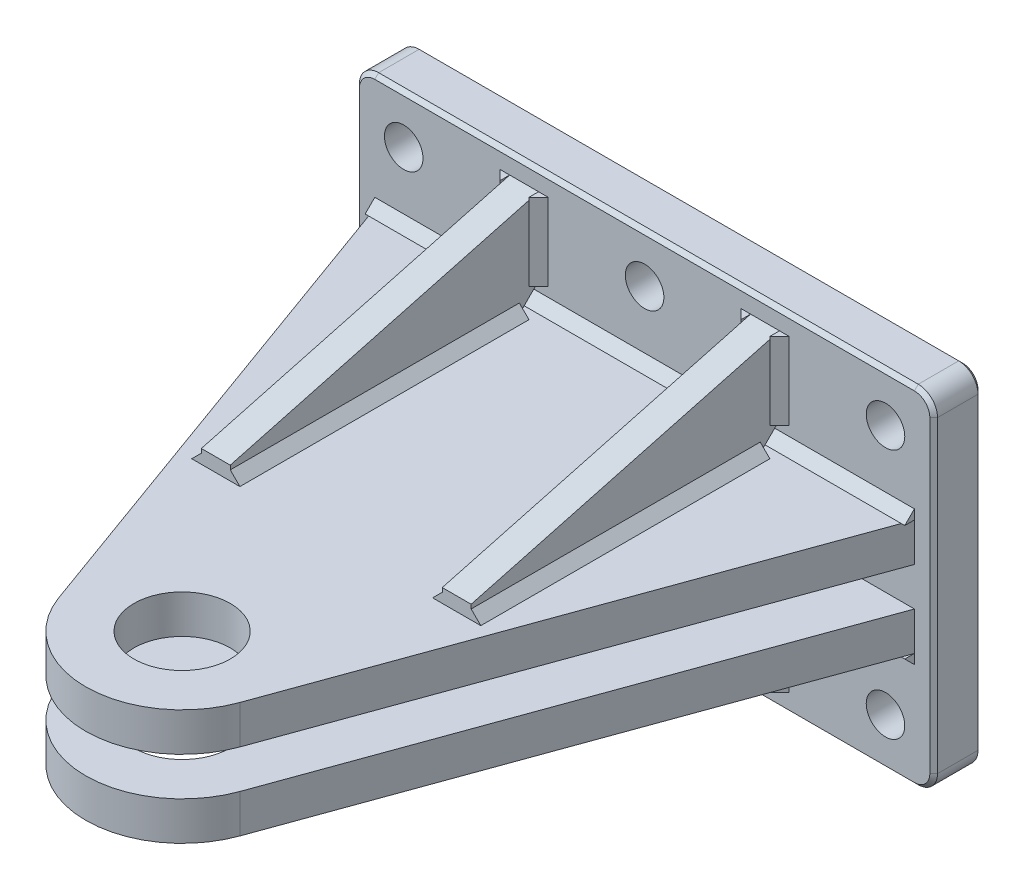
from build123d import *

# Parameters (mm, degrees)
SKETCH1_W           = 300
SKETCH1_H           = 180
SKETCH1_R           = 10
BOSS_EXTRUDE1_DEPTH = 12.5
FILLET1_R           = 10
CHAMFER1_SIZE       = 2
SKETCH6_W           = 280
SKETCH6_H           = 20
BOSS_EXTRUDE3_DEPTH = 290
SKETCH7_R           = 25
CUT_EXTRUDE2_DEPTH  = 359.338178262
SKETCH8_W           = 15
SKETCH8_H           = 50
BOSS_EXTRUDE4_DEPTH = 160
CUT_EXTRUDE3_DEPTH  = 385.715804198
GUSSET1_THICKNESS   = 280
GUSSET2_THICKNESS   = 150
GUSSET3_THICKNESS   = 150
GUSSET4_THICKNESS   = 150
GUSSET5_THICKNESS   = 150
GUSSET6_THICKNESS   = 40
GUSSET7_THICKNESS   = 40
GUSSET8_THICKNESS   = 40
GUSSET9_THICKNESS   = 40
MIRROR1_START       = 22.5
MIRROR1_DEPTH       = 150
MIRROR1_START_2     = -140
MIRROR1_2_DEPTH     = 280
MIRROR1_3_DEPTH     = 150
MIRROR1_START_3     = 40
MIRROR1_4_DEPTH     = 40


with BuildPart() as part:
    # Sketch1 → Boss-Extrude1 (new, symmetric)
    with BuildSketch(Plane.XY):
        Rectangle(SKETCH1_W, SKETCH1_H)
        with Locations((-125, 65)):
            Circle(SKETCH1_R, mode=Mode.SUBTRACT)
        with Locations((0, 65)):
            Circle(SKETCH1_R, mode=Mode.SUBTRACT)
        with Locations((125, 65)):
            Circle(SKETCH1_R, mode=Mode.SUBTRACT)
        with Locations(Location((125, -65, 0), (0, 0, 180))):
            Circle(SKETCH1_R, mode=Mode.SUBTRACT)
        with Locations(Location((0, -65, 0), (0, 0, 180))):
            Circle(SKETCH1_R, mode=Mode.SUBTRACT)
        with Locations(Location((-125, -65, 0), (0, 0, 180))):
            Circle(SKETCH1_R, mode=Mode.SUBTRACT)
    extrude(amount=BOSS_EXTRUDE1_DEPTH, both=True)

    # Fillet1
    fillet1_edges = [part.edges().sort_by_distance(p)[0] for p in [
        (150, -90, 0),
        (-150, -90, 0),
        (-150, 90, 0),
        (150, 90, 0),
    ]]
    fillet(fillet1_edges, radius=FILLET1_R)

    # Chamfer1
    chamfer1_edges = [part.edges().sort_by_distance(p)[0] for p in [
        (0, 90, -12.5),
        (0, 90, 12.5),
        (150, 0, -12.5),
        (0, -90, -12.5),
        (-150, 0, -12.5),
        (-147.071067812, 87.071067812, -12.5),
        (-147.071067812, -87.071067812, -12.5),
        (147.071067812, -87.071067812, -12.5),
        (147.071067812, 87.071067812, -12.5),
        (150, 0, 12.5),
        (-150, 0, 12.5),
        (0, -90, 12.5),
        (-147.071067812, 87.071067812, 12.5),
        (-147.071067812, -87.071067812, 12.5),
        (147.071067812, -87.071067812, 12.5),
        (147.071067812, 87.071067812, 12.5),
    ]]
    chamfer(chamfer1_edges, length=CHAMFER1_SIZE)

    # Sketch6 → Boss-Extrude3 (add)
    with BuildSketch(Plane.XY.offset(12.5)):
        with Locations((0, -20)):
            Rectangle(SKETCH6_W, SKETCH6_H)
        with Locations((0, 20)):
            Rectangle(SKETCH6_W, SKETCH6_H)
    extrude(amount=BOSS_EXTRUDE3_DEPTH)

    # Sketch7 → Cut-Extrude2 (cut, through all)
    with BuildSketch(Plane.XZ.offset(30)):
        with Locations(Location((0, 252.5, 0), (0, 0, 270))):
            Circle(SKETCH7_R)
        with BuildLine():
            Line((-47.017565913, 269.510246783), (-140, 12.5))
            Line((-140, 12.5), (-140, 338.026401393))
            Line((-140, 338.026401393), (140, 338.026401393))
            Line((140, 338.026401393), (140, 12.5))
            Line((140, 12.5), (47.017565913, 269.510246783))
            ThreePointArc((47.017565913, 269.510246783), (0, 302.5), (-47.017565913, 269.510246783))
        make_face()
    extrude(amount=-CUT_EXTRUDE2_DEPTH, mode=Mode.SUBTRACT)

    # Sketch8 → Boss-Extrude4 (add)
    with BuildSketch(Plane.XY.offset(12.5)):
        with Locations((62.5, -55)):
            Rectangle(SKETCH8_W, SKETCH8_H)
        with Locations((-62.5, -55)):
            Rectangle(SKETCH8_W, SKETCH8_H)
        with Locations((62.5, 55)):
            Rectangle(SKETCH8_W, SKETCH8_H)
        with Locations((-62.5, 55)):
            Rectangle(SKETCH8_W, SKETCH8_H)
    extrude(amount=BOSS_EXTRUDE4_DEPTH)

    # Sketch9 → Cut-Extrude3 (cut, through all)
    with BuildSketch(Plane.ZY.offset(70)):
        Polygon((12.5, 80), (172.5, 37.128129211), (172.5, 80), align=None)
        Polygon((22.5, 30), (12.5, 40), (12.5, 30), align=None)
        Polygon((12.5, -40), (12.5, -30), (22.5, -30), align=None)
        Polygon((172.5, -37.128129211), (176.037028875, -86.220399065), (12.5, -80), align=None)
    extrude(amount=-CUT_EXTRUDE3_DEPTH, mode=Mode.SUBTRACT)

    # Mirror1: read off the stored shape, not the designer's step
    # Mirror1 outline → Mirror1 (add)
    with BuildSketch(Plane.XY.offset(MIRROR1_START)):
        Polygon((70, 35), (70, 30), (75, 30), align=None)
        Polygon((-75, 30), (-70, 30), (-70, 35), align=None)
        Polygon((-50, 30), (-55, 35), (-55, 30), align=None)
    extrude(amount=MIRROR1_DEPTH)

    # Mirror1 2 outline → Mirror1 2 (add)
    with BuildSketch(Plane.YZ.offset(MIRROR1_START_2)):
        Polygon((30, 17.5), (30, 12.5), (35, 12.5), align=None)
    extrude(amount=MIRROR1_2_DEPTH)

    # Mirror1 3 outline → Mirror1 3 (add)
    with BuildSketch(Plane.XY.offset(MIRROR1_START)):
        Polygon((55, 35), (50, 30), (55, 30), align=None)
    extrude(amount=MIRROR1_3_DEPTH)

    # Mirror1 4 outline → Mirror1 4 (add)
    with BuildSketch(Plane(origin=(0, 0, 0), x_dir=(1, 0, 0), z_dir=(0, 1, 0)).offset(MIRROR1_START_3)):
        Polygon((-70, -17.5), (-70, -12.5), (-75, -12.5), align=None)
        Polygon((75, -12.5), (70, -12.5), (70, -17.5), align=None)
        Polygon((55, -12.5), (50, -12.5), (55, -17.5), align=None)
        Polygon((-55, -17.5), (-50, -12.5), (-55, -12.5), align=None)
    extrude(amount=MIRROR1_4_DEPTH)


with BuildPart() as body_2:
    # Gusset1: a gusset: a plate 280.0 thick in the corner of two members, its outline drawn in place
    gusset1_outline = Wire([Line((-140, -30, 12.5), (-140, -35, 12.5)), Line((-140, -35, 12.5), (-140, -30, 17.5)), Line((-140, -30, 17.5), (-140, -30, 12.5))])
    add(extrude(Face(gusset1_outline), amount=GUSSET1_THICKNESS, dir=(1, 0, 0)))


with BuildPart() as body_3:
    # Gusset2: a gusset: a plate 150.0 thick in the corner of two members, its outline drawn in place
    gusset2_outline = Wire([Line((-55, -30, 22.5), (-50, -30, 22.5)), Line((-50, -30, 22.5), (-55, -35, 22.5)), Line((-55, -35, 22.5), (-55, -30, 22.5))])
    add(extrude(Face(gusset2_outline), amount=GUSSET2_THICKNESS, dir=(0, 0, 1)))


with BuildPart() as body_4:
    # Gusset3: a gusset: a plate 150.0 thick in the corner of two members, its outline drawn in place
    gusset3_outline = Wire([Line((55, -30, 172.5), (50, -30, 172.5)), Line((50, -30, 172.5), (55, -35, 172.5)), Line((55, -35, 172.5), (55, -30, 172.5))])
    add(extrude(Face(gusset3_outline), amount=GUSSET3_THICKNESS, dir=(0, 0, -1)))


with BuildPart() as body_5:
    # Gusset4: a gusset: a plate 150.0 thick in the corner of two members, its outline drawn in place
    gusset4_outline = Wire([Line((70, -30, 22.5), (75, -30, 22.5)), Line((75, -30, 22.5), (70, -35, 22.5)), Line((70, -35, 22.5), (70, -30, 22.5))])
    add(extrude(Face(gusset4_outline), amount=GUSSET4_THICKNESS, dir=(0, 0, 1)))


with BuildPart() as body_6:
    # Gusset5: a gusset: a plate 150.0 thick in the corner of two members, its outline drawn in place
    gusset5_outline = Wire([Line((-70, -30, 172.5), (-75, -30, 172.5)), Line((-75, -30, 172.5), (-70, -35, 172.5)), Line((-70, -35, 172.5), (-70, -30, 172.5))])
    add(extrude(Face(gusset5_outline), amount=GUSSET5_THICKNESS, dir=(0, 0, -1)))


with BuildPart() as body_7:
    # Gusset6: a gusset: a plate 40.0 thick in the corner of two members, its outline drawn in place
    gusset6_outline = Wire([Line((-55, -40, 12.5), (-55, -40, 17.5)), Line((-55, -40, 17.5), (-50, -40, 12.5)), Line((-50, -40, 12.5), (-55, -40, 12.5))])
    add(extrude(Face(gusset6_outline), amount=GUSSET6_THICKNESS, dir=(0, -1, 0)))


with BuildPart() as body_8:
    # Gusset7: a gusset: a plate 40.0 thick in the corner of two members, its outline drawn in place
    gusset7_outline = Wire([Line((-70, -40, 12.5), (-75, -40, 12.5)), Line((-75, -40, 12.5), (-70, -40, 17.5)), Line((-70, -40, 17.5), (-70, -40, 12.5))])
    add(extrude(Face(gusset7_outline), amount=GUSSET7_THICKNESS, dir=(0, -1, 0)))


with BuildPart() as body_9:
    # Gusset8: a gusset: a plate 40.0 thick in the corner of two members, its outline drawn in place
    gusset8_outline = Wire([Line((70, -80, 12.5), (75, -80, 12.5)), Line((75, -80, 12.5), (70, -80, 17.5)), Line((70, -80, 17.5), (70, -80, 12.5))])
    add(extrude(Face(gusset8_outline), amount=GUSSET8_THICKNESS, dir=(0, 1, 0)))


with BuildPart() as body_10:
    # Gusset9: a gusset: a plate 40.0 thick in the corner of two members, its outline drawn in place
    gusset9_outline = Wire([Line((55, -40, 12.5), (50, -40, 12.5)), Line((50, -40, 12.5), (55, -40, 17.5)), Line((55, -40, 17.5), (55, -40, 12.5))])
    add(extrude(Face(gusset9_outline), amount=GUSSET9_THICKNESS, dir=(0, -1, 0)))


solid = Compound([part.part, body_2.part, body_3.part, body_4.part, body_5.part, body_6.part, body_7.part, body_8.part, body_9.part, body_10.part])
